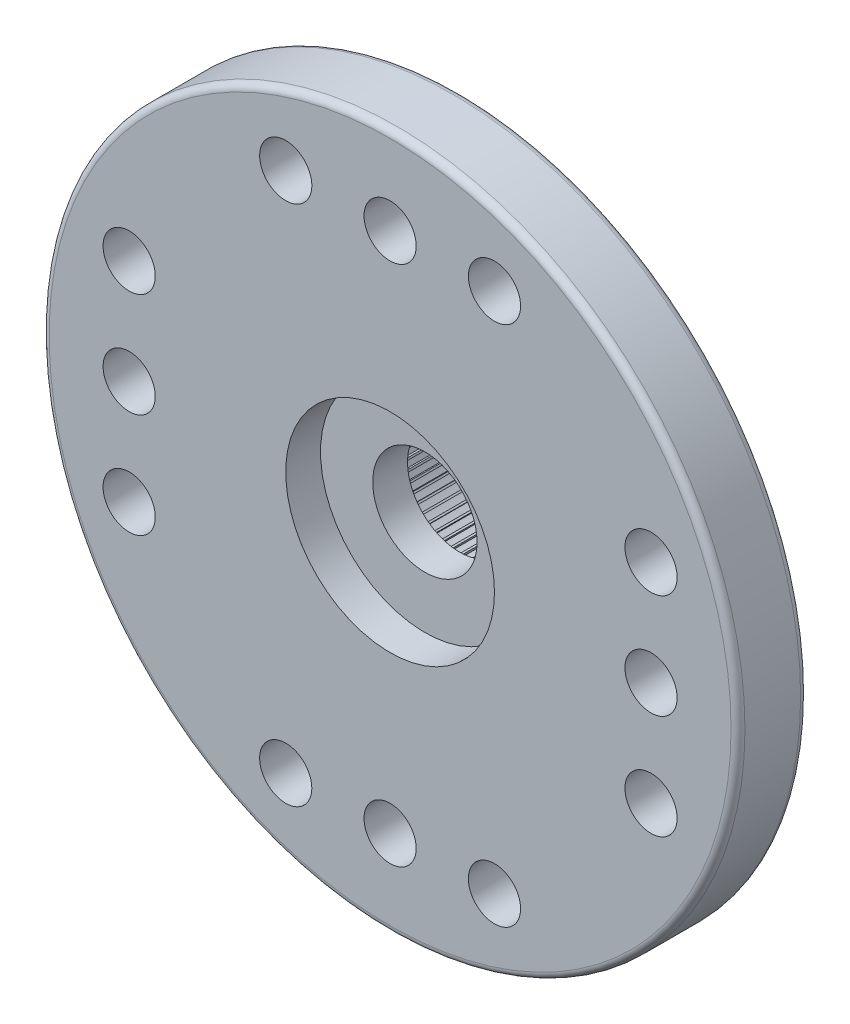
from build123d import *

# Parameters (mm, degrees)
SKETCH1_R           = 10
SKETCH1_R_2         = 1.5
BOSS_EXTRUDE1_DEPTH = 2
SKETCH2_R           = 0.75
CUT_EXTRUDE1_DEPTH  = 15.282856857
SKETCH3_R           = 3
CUT_EXTRUDE2_DEPTH  = 1
SKETCH4_R           = 4
SKETCH4_R_2         = 3
BOSS_EXTRUDE2_DEPTH = 4
SKETCH5_W           = 0.05
SKETCH5_H           = 0.5
BOSS_EXTRUDE3_DEPTH = 4
CIRPATTERN3_COUNT   = 80
FILLET3_R           = 0.2


with BuildPart() as part:
    # Sketch1 → Boss-Extrude1 (new body)
    with BuildSketch(Plane.XY):
        Circle(SKETCH1_R)
        Circle(SKETCH1_R_2, mode=Mode.SUBTRACT)
    extrude(amount=BOSS_EXTRUDE1_DEPTH)

    # Sketch2 → Cut-Extrude1 (cut, through all)
    with BuildSketch(Plane.XY.offset(2)):
        with Locations((0, 7.5)):
            Circle(SKETCH2_R)
        with Locations((7.5, 0)):
            Circle(SKETCH2_R)
        with Locations((7.5, -3)):
            Circle(SKETCH2_R)
        with Locations(Location((7.5, 3, 0), (0, 0, 180))):
            Circle(SKETCH2_R)
        with Locations((3, 7.5)):
            Circle(SKETCH2_R)
        with Locations(Location((-3, 7.5, 0), (0, 0, 180))):
            Circle(SKETCH2_R)
        with Locations((0, -7.5)):
            Circle(SKETCH2_R)
        with Locations((-3, -7.5)):
            Circle(SKETCH2_R)
        with Locations(Location((3, -7.5, 0), (0, 0, 180))):
            Circle(SKETCH2_R)
        with Locations((-7.5, 0)):
            Circle(SKETCH2_R)
        with Locations((-7.5, 3)):
            Circle(SKETCH2_R)
        with Locations(Location((-7.5, -3, 0), (0, 0, 180))):
            Circle(SKETCH2_R)
    extrude(amount=-CUT_EXTRUDE1_DEPTH, mode=Mode.SUBTRACT)

    # Sketch3 → Cut-Extrude2 (cut)
    with BuildSketch(Plane.XY.offset(2)):
        Circle(SKETCH3_R)
    extrude(amount=-CUT_EXTRUDE2_DEPTH, mode=Mode.SUBTRACT)

    # Sketch4 → Boss-Extrude2 (add)
    with BuildSketch(Plane(origin=(0, 0, 0), x_dir=(-1, 0, 0), z_dir=(0, 0, -1))):
        with Locations(Location((0, 0, 0), (0, 0, 180))):
            Circle(SKETCH4_R)
        with Locations(Location((0, 0, 0), (0, 0, 180))):
            Circle(SKETCH4_R_2, mode=Mode.SUBTRACT)
    extrude(amount=BOSS_EXTRUDE2_DEPTH)

    # Sketch5 → Boss-Extrude3 (add)
    with BuildSketch(Plane(origin=(0, 0, -4), x_dir=(-1, 0, 0), z_dir=(0, 0, -1))):
        with Locations((0, -3.144105088)):
            Rectangle(SKETCH5_W, SKETCH5_H)
    boss_extrude3 = extrude(amount=-BOSS_EXTRUDE3_DEPTH)

    # CirPattern3: Boss-Extrude3 ×80 about axis
    cirpattern3_axis = Axis((0, 0, 0), (0, 0, 1))
    for i in range(1, CIRPATTERN3_COUNT):
        add(boss_extrude3.rotate(cirpattern3_axis, i * 360 / CIRPATTERN3_COUNT))

    # Fillet3
    fillet3_edges = [part.edges().sort_by_distance(p)[0] for p in [
        (-10, 0, 2),
        (-10, 0, 0),
        (-4, 0, 0),
        (-4, 0, -4),
    ]]
    fillet(fillet3_edges, radius=FILLET3_R)


solid = part.part
